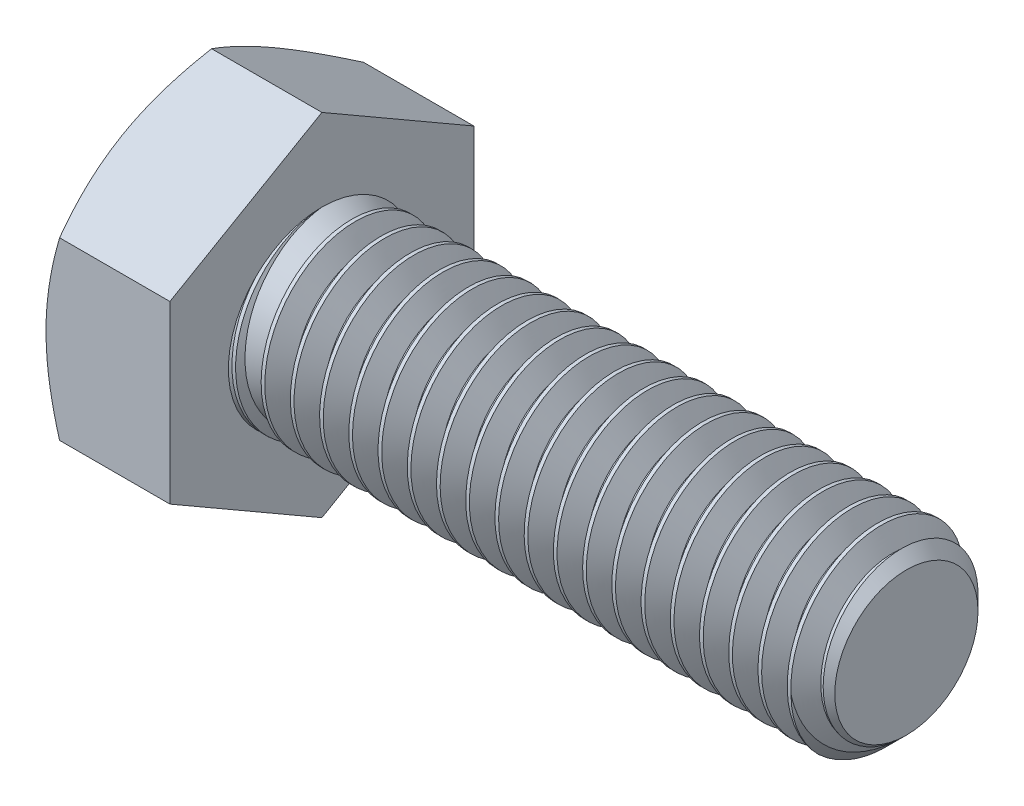
from build123d import *

# Parameters (mm, degrees)
SKETCH2_R           = 4
BOSS_EXTRUDE1_DEPTH = 25
CHAMFER1_SIZE       = 0.9375
BOSS_EXTRUDE2_DEPTH = 5.3
SKETCH6_OUTSIDE_W   = 136.164
SKETCH6_OUTSIDE_H   = 138.176
SKETCH6_OUTSIDE_R   = 6.5
CUT_EXTRUDE1_DEPTH  = 32.885315324
CUT_EXTRUDE1_DRAFT  = -60
SKETCH7_W           = 0.346153846
SKETCH7_H           = 0.346153846
CUT_EXTRUDE2_DEPTH  = 0.5
CUT_SWEEP1_PITCH    = 1.25
CUT_SWEEP1_TO       = 25


with BuildPart() as part:
    # Sketch2 → Boss-Extrude1 (new body)
    with BuildSketch(Plane(origin=(15.15, 0, 0), x_dir=(0, 0, -1), z_dir=(1, 0, 0))):
        Circle(SKETCH2_R)
    extrude(amount=-BOSS_EXTRUDE1_DEPTH)

    # Chamfer1
    chamfer1_edges = [part.edges().sort_by_distance(p)[0] for p in [
        (15.15, 0, 4),
    ]]
    chamfer(chamfer1_edges, length=CHAMFER1_SIZE)

    # Cut-Sweep1: arcs per turn and ends read off the stored shape
    # Cut-Sweep1: the profile of Sketch5 profile screwed along a right-hand helix through 21 turns, 8 arcs to a turn; built about Z, then put on its axis
    cut_sweep1_z = Axis((0, 0, 0), (0, 0, 1))
    cut_sweep1_corners = [(4.0003, 0, 0.000173205), (3.188101184, 0, -0.46875), (3.188101184, 0, -0.625), (4.0003, 0, -1.093923205)]
    with BuildLine(mode=Mode.PRIVATE) as cut_sweep1_profile:
        Line(cut_sweep1_corners[0], cut_sweep1_corners[1])
        Line(cut_sweep1_corners[1], cut_sweep1_corners[2])
        Line(cut_sweep1_corners[2], cut_sweep1_corners[3])
        Line(cut_sweep1_corners[3], cut_sweep1_corners[0])
    cut_sweep1_cap = Face(cut_sweep1_profile.wire())
    cut_sweep1_turn_angles = [0, 22.5, 45, 67.5, 90, 112.5, 135, 157.5, 180, 202.5, 225, 247.5, 270, 292.5, 315, 337.5, 360]
    cut_sweep1_turn_weights = [1, 0.9238795325112867, 1, 0.9238795325112867, 1, 0.9238795325112867, 1, 0.9238795325112867, 1, 0.9238795325112867, 1, 0.9238795325112867, 1, 0.9238795325112867, 1, 0.9238795325112867, 1]
    cut_sweep1_turn_rails = [Edge.make_bspline([Vector(p[0], p[1], 0).rotate(cut_sweep1_z, cut_sweep1_turn_angles[k]) / cut_sweep1_turn_weights[k] + Vector(0, 0, p[2] + CUT_SWEEP1_PITCH * cut_sweep1_turn_angles[k] / 360) for k in range(17)], [0, 0, 0, 1, 1, 2, 2, 3, 3, 4, 4, 5, 5, 6, 6, 7, 7, 8, 8, 8], 2, cut_sweep1_turn_weights) for p in cut_sweep1_corners]
    cut_sweep1_turn_sides = [Face.make_surface_from_curves(cut_sweep1_turn_rails[p[0]], cut_sweep1_turn_rails[p[1]]) for p in [(0, 1), (1, 2), (2, 3), (3, 0)]]
    cut_sweep1 = Plane(origin=(15.15, 0, 0), x_dir=(0, 1, 0), z_dir=(-1, 0, 0)) * split(Solid(Shell([*[p.moved(Location((0, 0, CUT_SWEEP1_PITCH * i))) for i in range(21) for p in cut_sweep1_turn_sides], cut_sweep1_cap, cut_sweep1_cap.rotate(cut_sweep1_z, 7560).moved(Location((0, 0, CUT_SWEEP1_PITCH * 7560 / 360)))])), bisect_by=Plane.XY.offset(CUT_SWEEP1_TO), keep=Keep.BOTTOM, mode=Mode.PRIVATE)
    add(cut_sweep1, mode=Mode.SUBTRACT)

    # Sketch8 → Min Thread (revolve)
    with BuildSketch(Plane.XY, mode=Mode.PRIVATE) as min_thread_sk:
        Polygon((-9.86, 4), (-9.85, 4), (-2.92179677, 0), (-9.86, 0), align=None)
    revolve(min_thread_sk.sketch.rotate(Axis((-15.15, 0, 0), (1, 0, 0)), 90), axis=Axis((-15.15, 0, 0), (1, 0, 0)))


with BuildPart() as body_2:
    # Sketch3 → Boss-Extrude2 (new body)
    with BuildSketch(Plane.ZY.offset(9.85)):
        Polygon((-6.5, -3.75277675), (0, -7.505553499), (6.5, -3.75277675), (6.5, 3.75277675), (0, 7.505553499), (-6.5, 3.75277675), align=None)
    extrude(amount=BOSS_EXTRUDE2_DEPTH)


with BuildPart() as cut_extrude1_tool:
    # Sketch6 outside → Cut-Extrude1 (with draft: the straight prism first)
    with BuildSketch(Plane.ZY.offset(15.15)):
        Rectangle(SKETCH6_OUTSIDE_W, SKETCH6_OUTSIDE_H)
        Circle(SKETCH6_OUTSIDE_R, mode=Mode.SUBTRACT)
    extrude(amount=-CUT_EXTRUDE1_DEPTH)
    # Cut-Extrude1: the draft: its side faces are tilted about the plane it starts from
    cut_extrude1_sides = [cut_extrude1_tool.faces().sort_by_distance(p)[0] for p in [
        (1.292657662, -69.088, 0),
        (1.292657662, 0, 68.082),
        (1.292657662, 69.088, 0),
        (1.292657662, 0, -68.082),
        (1.292657662, 0, -6.5),
    ]]
    draft(cut_extrude1_sides, Plane.ZY.offset(15.15), CUT_EXTRUDE1_DRAFT)


with BuildPart() as body_2_1:
    add(body_2.part)

    # Cut-Extrude1: cut by cut_extrude1_tool
    add(cut_extrude1_tool.part, mode=Mode.SUBTRACT)

    # Sketch7 → Cut-Extrude2 (cut)
    # profile 1 of 3: a face of its own
    with BuildSketch(Plane.ZY.offset(15.15)):
        with BuildLine():
            add(Edge.make_bspline(
                [(-1.910336538, 3.64755609), (-1.943180426, 3.660404805), (-2.00615305, 3.685040052), (-2.091086884, 3.734342115), (-2.162969799, 3.791057647), (-2.220919166, 3.856554304), (-2.26508712, 3.929478092), (-2.296889792, 4.008899236), (-2.315517176, 4.095260198), (-2.317968755, 4.154976579), (-2.319230769, 4.185717147)],
                knots=[0, 0, 0, 0, 1.16287356, 2.229614231, 3.228817875, 4.173350329, 5.100165549, 6.029633206, 6.985702163, 8, 8, 8, 8], degree=3))
            add(Edge.make_bspline(
                [(-2.319230769, 4.185717147), (-2.318636798, 4.20937066), (-2.317470813, 4.255803243), (-2.307396443, 4.323935199), (-2.291260887, 4.389222658), (-2.268360758, 4.451481353), (-2.239670649, 4.51122373), (-2.20346857, 4.567355283), (-2.161856529, 4.621462402), (-2.11311, 4.671357913), (-2.059392168, 4.717057372), (-2.001207373, 4.757725402), (-1.938110384, 4.790981964), (-1.871153207, 4.818787252), (-1.800004772, 4.840555852), (-1.724414457, 4.855381482), (-1.644648734, 4.864811683), (-1.589991366, 4.866038709), (-1.562019231, 4.866666667)],
                knots=[0, 0, 0, 0, 0.994101948, 1.951453197, 2.889123786, 3.817215529, 4.736003873, 5.669743943, 6.620499649, 7.601567446, 8.596478358, 9.582687259, 10.579761808, 11.589151689, 12.62747492, 13.702346593, 14.8241243, 16, 16, 16, 16], degree=3))
            add(Edge.make_bspline(
                [(-1.562019231, 4.866666667), (-1.533868855, 4.866032333), (-1.479035099, 4.864796722), (-1.398845596, 4.855493227), (-1.322778257, 4.83989999), (-1.250877866, 4.817777112), (-1.183031069, 4.78949168), (-1.119683689, 4.754725171), (-1.060183601, 4.714050995), (-1.006051608, 4.6669841), (-0.956797946, 4.615884757), (-0.9141243, 4.561140064), (-0.877524473, 4.504027453), (-0.847280214, 4.444199951), (-0.824905397, 4.380976282), (-0.807850765, 4.31554761), (-0.797958287, 4.247136515), (-0.796762831, 4.200712466), (-0.796153846, 4.177063301)],
                knots=[0, 0, 0, 0, 1.171211919, 2.281388661, 3.353996503, 4.398126828, 5.406889753, 6.407389155, 7.400009931, 8.40008733, 9.387021643, 10.349004252, 11.283445052, 12.206096336, 13.131640667, 14.068727932, 15.016178647, 16, 16, 16, 16], degree=3))
            add(Edge.make_bspline(
                [(-0.796153846, 4.177063301), (-0.797143123, 4.147382227), (-0.799082909, 4.089183224), (-0.818850195, 4.005288878), (-0.849659202, 3.926969301), (-0.894187514, 3.855717128), (-0.950580964, 3.790796484), (-1.020560739, 3.734360256), (-1.103064068, 3.685135244), (-1.164446732, 3.66041967), (-1.196394231, 3.64755609)],
                knots=[0, 0, 0, 0, 0.998680737, 1.958225066, 2.887911823, 3.823713378, 4.77537694, 5.772726054, 6.840782926, 8, 8, 8, 8], degree=3))
            add(Edge.make_bspline(
                [(-1.196394231, 3.64755609), (-1.176237433, 3.640713812), (-1.136738854, 3.627305916), (-1.080899649, 3.601236835), (-1.028328715, 3.573128177), (-0.9787296, 3.542700537), (-0.933933129, 3.507691086), (-0.89244476, 3.470169786), (-0.854438929, 3.429607888), (-0.820434755, 3.38566041), (-0.790075954, 3.339249733), (-0.76408641, 3.290262707), (-0.74201399, 3.239396598), (-0.723150139, 3.18641553), (-0.709371588, 3.13094631), (-0.699730919, 3.073243849), (-0.693614187, 3.013612259), (-0.692747719, 2.973111786), (-0.692307692, 2.952544071)],
                knots=[0, 0, 0, 0, 1.104208047, 2.163768705, 3.193778962, 4.198696312, 5.179575955, 6.14024585, 7.100368562, 8.060719304, 9.021161243, 9.975749006, 10.935506756, 11.897452199, 12.89163552, 13.897859372, 14.932451246, 16, 16, 16, 16], degree=3))
            add(Edge.make_bspline(
                [(-0.692307692, 2.952544071), (-0.692995599, 2.924196188), (-0.694350828, 2.868348698), (-0.706258296, 2.786371137), (-0.724274822, 2.707620503), (-0.750544997, 2.632429469), (-0.784098538, 2.560744881), (-0.825604673, 2.492670833), (-0.874655591, 2.428277351), (-0.929804375, 2.367364281), (-0.991460683, 2.312301503), (-1.058161387, 2.263779047), (-1.130156757, 2.223135303), (-1.206573243, 2.189482429), (-1.287776753, 2.163401577), (-1.373662906, 2.14513945), (-1.464203122, 2.134265157), (-1.526111717, 2.132799128), (-1.557692308, 2.132051282)],
                knots=[0, 0, 0, 0, 1.017598406, 2.004746413, 2.969099523, 3.915171376, 4.859468899, 5.806714415, 6.772805022, 7.762836953, 8.753334612, 9.736396794, 10.719437652, 11.716790048, 12.730404696, 13.776887535, 14.865953843, 16, 16, 16, 16], degree=3))
            add(Edge.make_bspline(
                [(-1.557692308, 2.132051282), (-1.589269739, 2.132815245), (-1.651172142, 2.134312869), (-1.74179508, 2.144964853), (-1.827558352, 2.164054851), (-1.908656278, 2.190162214), (-1.985528787, 2.222903933), (-2.05704064, 2.264463483), (-2.124177032, 2.312924465), (-2.185876211, 2.368327822), (-2.241483088, 2.429234395), (-2.289887407, 2.494578868), (-2.331147142, 2.563355612), (-2.365103008, 2.635952336), (-2.390985122, 2.712369703), (-2.409149496, 2.792320814), (-2.421078516, 2.875744574), (-2.422401401, 2.932670136), (-2.423076923, 2.961738782)],
                knots=[0, 0, 0, 0, 1.127066097, 2.209429196, 3.250843736, 4.258219581, 5.246860502, 6.227045772, 7.204057202, 8.19754525, 9.181483529, 10.142920909, 11.095356922, 12.039670968, 12.998174893, 13.969127444, 14.962948905, 16, 16, 16, 16], degree=3))
            add(Edge.make_bspline(
                [(-2.423076923, 2.961738782), (-2.422607384, 2.983382552), (-2.421686068, 3.025851375), (-2.41605806, 3.08814158), (-2.404841548, 3.147510694), (-2.390393966, 3.204308577), (-2.372050057, 3.258677322), (-2.349419354, 3.310189972), (-2.321962481, 3.358722026), (-2.290769673, 3.404589279), (-2.255447312, 3.447469728), (-2.216567893, 3.486987858), (-2.173990186, 3.522694177), (-2.12867099, 3.555631559), (-2.078710685, 3.58347011), (-2.02596728, 3.609017167), (-1.969533975, 3.63080407), (-1.930266639, 3.641916159), (-1.910336538, 3.64755609)],
                knots=[0, 0, 0, 0, 1.117345089, 2.192424383, 3.22371675, 4.232639188, 5.215561493, 6.182180952, 7.132172269, 8.089790513, 9.041830748, 9.996006267, 10.94686322, 11.907506267, 12.882866327, 13.894317773, 14.931262935, 16, 16, 16, 16], degree=3))
        make_face()
        with BuildLine():
            add(Edge.make_bspline(
                [(-1.973076923, 4.184094551), (-1.972049542, 4.156538278), (-1.970064187, 4.103287334), (-1.948473236, 4.027648269), (-1.914711255, 3.959703177), (-1.875131256, 3.910430969), (-1.837183978, 3.876859266), (-1.805511748, 3.854444632), (-1.770900126, 3.835415061), (-1.733098366, 3.820624078), (-1.693022029, 3.807520188), (-1.649288938, 3.800196066), (-1.602927014, 3.79424199), (-1.570875935, 3.793810776), (-1.554447115, 3.793589744)],
                knots=[0, 0, 0, 0, 1.528727296, 2.954179336, 4.335216052, 5.725683216, 6.435919001, 7.148062981, 7.879427438, 8.626027458, 9.402978632, 10.2190538, 11.08711833, 12, 12, 12, 12], degree=3))
            add(Edge.make_bspline(
                [(-1.554447115, 3.793589744), (-1.538380947, 3.793818944), (-1.507052798, 3.794265872), (-1.461735055, 3.800098562), (-1.418909946, 3.807888668), (-1.3792103, 3.819693376), (-1.342177786, 3.83504294), (-1.308414724, 3.853965163), (-1.276910759, 3.875712227), (-1.240078231, 3.909540416), (-1.200552852, 3.957086917), (-1.166677726, 4.021996805), (-1.145568189, 4.093012076), (-1.143413605, 4.142478353), (-1.142307692, 4.16786859)],
                knots=[0, 0, 0, 0, 0.922112375, 1.798068639, 2.620552757, 3.419964248, 4.17189205, 4.918165909, 5.639229138, 6.36503528, 7.785020832, 9.165298717, 10.544993853, 12, 12, 12, 12], degree=3))
            add(Edge.make_bspline(
                [(-1.142307692, 4.16786859), (-1.143640162, 4.194146397), (-1.14624746, 4.245565262), (-1.167305433, 4.31937936), (-1.202758374, 4.386232888), (-1.243258445, 4.435055073), (-1.280742538, 4.470423871), (-1.312812092, 4.49293848), (-1.347286981, 4.512100404), (-1.384298418, 4.527748695), (-1.423899923, 4.540369204), (-1.466198772, 4.548648866), (-1.511017225, 4.554455684), (-1.541806577, 4.554899314), (-1.557692308, 4.555128205)],
                knots=[0, 0, 0, 0, 1.480633456, 2.897216237, 4.289382554, 5.720567045, 6.454675042, 7.191244726, 7.924224627, 8.676083236, 9.454506446, 10.26432127, 11.104478565, 12, 12, 12, 12], degree=3))
            add(Edge.make_bspline(
                [(-1.557692308, 4.555128205), (-1.573579806, 4.554906717), (-1.604551709, 4.554474937), (-1.64966241, 4.548493868), (-1.692362125, 4.540981766), (-1.732256921, 4.528926234), (-1.769180969, 4.513172455), (-1.803519942, 4.493999768), (-1.835528731, 4.472060259), (-1.873276176, 4.438268612), (-1.912810406, 4.390721035), (-1.947638951, 4.326847835), (-1.969164119, 4.25720449), (-1.9717565, 4.208766379), (-1.973076923, 4.184094551)],
                knots=[0, 0, 0, 0, 0.914830409, 1.783417199, 2.618873138, 3.411020283, 4.179090249, 4.927874451, 5.674348476, 6.410336976, 7.841713217, 9.213201474, 10.580551314, 12, 12, 12, 12], degree=3))
        make_face(mode=Mode.SUBTRACT)
        with BuildLine():
            add(Edge.make_bspline(
                [(-2.076923077, 2.968229167), (-2.076324499, 2.94601804), (-2.075125766, 2.901537279), (-2.064610298, 2.835473923), (-2.046767727, 2.770640787), (-2.023899366, 2.706976633), (-1.99164212, 2.647051056), (-1.948865385, 2.593563069), (-1.895188595, 2.548593595), (-1.833886765, 2.510601677), (-1.766990707, 2.48069877), (-1.697283059, 2.459825525), (-1.626562939, 2.446033526), (-1.578849029, 2.444404431), (-1.554987981, 2.443589744)],
                knots=[0, 0, 0, 0, 0.957879255, 1.91828174, 2.876792425, 3.856375228, 4.831004356, 5.799187063, 6.79220414, 7.836856316, 8.902268238, 9.943090861, 10.971368942, 12, 12, 12, 12], degree=3))
            add(Edge.make_bspline(
                [(-1.554987981, 2.443589744), (-1.535311973, 2.443923041), (-1.497087099, 2.444570542), (-1.441367202, 2.451969635), (-1.388866461, 2.463196478), (-1.339344347, 2.478590321), (-1.29352977, 2.499650117), (-1.250676659, 2.524264444), (-1.211223346, 2.554012742), (-1.175181001, 2.58796306), (-1.142916712, 2.625518474), (-1.115278268, 2.666032559), (-1.091168927, 2.708365957), (-1.071484753, 2.753432288), (-1.057249922, 2.801324481), (-1.04626574, 2.851178458), (-1.039639307, 2.903508437), (-1.038859818, 2.939183641), (-1.038461538, 2.957411859)],
                knots=[0, 0, 0, 0, 1.149387474, 2.232932207, 3.278773642, 4.285224938, 5.256757121, 6.220082341, 7.168479488, 8.137608443, 9.109140627, 10.056190326, 10.999892409, 11.953252726, 12.923240661, 13.915357002, 14.934853301, 16, 16, 16, 16], degree=3))
            add(Edge.make_bspline(
                [(-1.038461538, 2.957411859), (-1.038872502, 2.975997875), (-1.039677104, 3.012386334), (-1.046135137, 3.065864847), (-1.057735242, 3.116595931), (-1.072653025, 3.165345986), (-1.092870887, 3.211266899), (-1.117139599, 3.255017122), (-1.146858912, 3.295443496), (-1.17944851, 3.333918503), (-1.216329021, 3.368747278), (-1.257056648, 3.398781447), (-1.300340642, 3.425306704), (-1.347490381, 3.445653816), (-1.397467093, 3.461952316), (-1.45050821, 3.473795055), (-1.506829994, 3.481034206), (-1.545410167, 3.48170571), (-1.565264423, 3.482051282)],
                knots=[0, 0, 0, 0, 1.065858887, 2.086781919, 3.082735321, 4.047496077, 5.006086125, 5.955204095, 6.910833714, 7.878747924, 8.844339535, 9.812198509, 10.776903849, 11.749116737, 12.749729282, 13.788304076, 14.861809717, 16, 16, 16, 16], degree=3))
            add(Edge.make_bspline(
                [(-1.565264423, 3.482051282), (-1.584579524, 3.481702271), (-1.622443135, 3.481018101), (-1.677448497, 3.473737944), (-1.729521675, 3.462558037), (-1.778204528, 3.446194755), (-1.824105741, 3.425747171), (-1.866385797, 3.400035797), (-1.90579897, 3.370192229), (-1.941141327, 3.335504758), (-1.973029292, 3.297824733), (-2.000599852, 3.257431862), (-2.024955649, 3.215263139), (-2.043438748, 3.169934854), (-2.059083037, 3.122912387), (-2.068863192, 3.073283084), (-2.07581566, 3.02161082), (-2.076548543, 2.986283126), (-2.076923077, 2.968229167)],
                knots=[0, 0, 0, 0, 1.135239447, 2.225422834, 3.256957183, 4.262780498, 5.240265059, 6.205773948, 7.16638056, 8.141101257, 9.111719309, 10.064571387, 11.014055337, 11.969087385, 12.938082716, 13.92369833, 14.938921288, 16, 16, 16, 16], degree=3))
        make_face(mode=Mode.SUBTRACT)
    # profile 2 of 3: a face of its own
    with BuildSketch(Plane.ZY.offset(15.15)):
        with Locations((0, 2.33974359)):
            Rectangle(SKETCH7_W, SKETCH7_H)
    # profile 3 of 3: a face of its own
    with BuildSketch(Plane.ZY.offset(15.15)):
        with BuildLine():
            add(Edge.make_bspline(
                [(1.205048077, 3.64755609), (1.172204189, 3.660404805), (1.109231566, 3.685040052), (1.024297731, 3.734342115), (0.952414817, 3.791057647), (0.894465449, 3.856554304), (0.850297496, 3.929478092), (0.818494823, 4.008899236), (0.79986744, 4.095260198), (0.797415861, 4.154976579), (0.796153846, 4.185717147)],
                knots=[0, 0, 0, 0, 1.16287356, 2.229614231, 3.228817875, 4.173350329, 5.100165549, 6.029633206, 6.985702163, 8, 8, 8, 8], degree=3))
            add(Edge.make_bspline(
                [(0.796153846, 4.185717147), (0.796747818, 4.20937066), (0.797913802, 4.255803243), (0.807988173, 4.323935199), (0.824123729, 4.389222658), (0.847023858, 4.451481353), (0.875713967, 4.51122373), (0.911916045, 4.567355283), (0.953528087, 4.621462402), (1.002274615, 4.671357913), (1.055992447, 4.717057372), (1.114177243, 4.757725402), (1.177274232, 4.790981964), (1.244231409, 4.818787252), (1.315379843, 4.840555852), (1.390970158, 4.855381482), (1.470735882, 4.864811683), (1.52539325, 4.866038709), (1.553365385, 4.866666667)],
                knots=[0, 0, 0, 0, 0.994101948, 1.951453197, 2.889123786, 3.817215529, 4.736003873, 5.669743943, 6.620499649, 7.601567446, 8.596478358, 9.582687259, 10.579761808, 11.589151689, 12.62747492, 13.702346593, 14.8241243, 16, 16, 16, 16], degree=3))
            add(Edge.make_bspline(
                [(1.553365385, 4.866666667), (1.581515761, 4.866032333), (1.636349517, 4.864796722), (1.71653902, 4.855493227), (1.792606359, 4.83989999), (1.86450675, 4.817777112), (1.932353546, 4.78949168), (1.995700927, 4.754725171), (2.055201014, 4.714050995), (2.109333008, 4.6669841), (2.15858667, 4.615884757), (2.201260315, 4.561140064), (2.237860143, 4.504027453), (2.268104401, 4.444199951), (2.290479218, 4.380976282), (2.307533851, 4.31554761), (2.317426328, 4.247136515), (2.318621785, 4.200712466), (2.319230769, 4.177063301)],
                knots=[0, 0, 0, 0, 1.171211919, 2.281388661, 3.353996503, 4.398126828, 5.406889753, 6.407389155, 7.400009931, 8.40008733, 9.387021643, 10.349004252, 11.283445052, 12.206096336, 13.131640667, 14.068727932, 15.016178647, 16, 16, 16, 16], degree=3))
            add(Edge.make_bspline(
                [(2.319230769, 4.177063301), (2.318241492, 4.147382227), (2.316301706, 4.089183224), (2.29653442, 4.005288878), (2.265725413, 3.926969301), (2.221197102, 3.855717128), (2.164803651, 3.790796484), (2.094823877, 3.734360256), (2.012320548, 3.685135244), (1.950937884, 3.66041967), (1.918990385, 3.64755609)],
                knots=[0, 0, 0, 0, 0.998680737, 1.958225066, 2.887911823, 3.823713378, 4.77537694, 5.772726054, 6.840782926, 8, 8, 8, 8], degree=3))
            add(Edge.make_bspline(
                [(1.918990385, 3.64755609), (1.939147182, 3.640713812), (1.978645761, 3.627305916), (2.034484967, 3.601236835), (2.0870559, 3.573128177), (2.136655016, 3.542700537), (2.181451487, 3.507691086), (2.222939855, 3.470169786), (2.260945686, 3.429607888), (2.29494986, 3.38566041), (2.325308662, 3.339249733), (2.351298205, 3.290262707), (2.373370626, 3.239396598), (2.392234476, 3.18641553), (2.406013028, 3.13094631), (2.415653696, 3.073243849), (2.421770428, 3.013612259), (2.422636897, 2.973111786), (2.423076923, 2.952544071)],
                knots=[0, 0, 0, 0, 1.104208047, 2.163768705, 3.193778962, 4.198696312, 5.179575955, 6.14024585, 7.100368562, 8.060719304, 9.021161243, 9.975749006, 10.935506756, 11.897452199, 12.89163552, 13.897859372, 14.932451246, 16, 16, 16, 16], degree=3))
            add(Edge.make_bspline(
                [(2.423076923, 2.952544071), (2.422389016, 2.924196188), (2.421033787, 2.868348698), (2.409126319, 2.786371137), (2.391109793, 2.707620503), (2.364839618, 2.632429469), (2.331286078, 2.560744881), (2.289779943, 2.492670833), (2.240729025, 2.428277351), (2.18558024, 2.367364281), (2.123923933, 2.312301503), (2.057223228, 2.263779047), (1.985227858, 2.223135303), (1.908811373, 2.189482429), (1.827607862, 2.163401577), (1.741721709, 2.14513945), (1.651181493, 2.134265157), (1.589272898, 2.132799128), (1.557692308, 2.132051282)],
                knots=[0, 0, 0, 0, 1.017598406, 2.004746413, 2.969099523, 3.915171376, 4.859468899, 5.806714415, 6.772805022, 7.762836953, 8.753334612, 9.736396794, 10.719437652, 11.716790048, 12.730404696, 13.776887535, 14.865953843, 16, 16, 16, 16], degree=3))
            add(Edge.make_bspline(
                [(1.557692308, 2.132051282), (1.526114876, 2.132815245), (1.464212473, 2.134312869), (1.373589535, 2.144964853), (1.287826264, 2.164054851), (1.206728338, 2.190162214), (1.129855828, 2.222903933), (1.058343976, 2.264463483), (0.991207584, 2.312924465), (0.929508405, 2.368327822), (0.873901528, 2.429234395), (0.825497209, 2.494578868), (0.784237474, 2.563355612), (0.750281607, 2.635952336), (0.724399494, 2.712369703), (0.70623512, 2.792320814), (0.694306099, 2.875744574), (0.692983214, 2.932670136), (0.692307692, 2.961738782)],
                knots=[0, 0, 0, 0, 1.127066097, 2.209429196, 3.250843736, 4.258219581, 5.246860502, 6.227045772, 7.204057202, 8.19754525, 9.181483529, 10.142920909, 11.095356922, 12.039670968, 12.998174893, 13.969127444, 14.962948905, 16, 16, 16, 16], degree=3))
            add(Edge.make_bspline(
                [(0.692307692, 2.961738782), (0.692777231, 2.983382552), (0.693698547, 3.025851375), (0.699326555, 3.08814158), (0.710543067, 3.147510694), (0.724990649, 3.204308577), (0.743334558, 3.258677322), (0.765965261, 3.310189972), (0.793422134, 3.358722026), (0.824614942, 3.404589279), (0.859937303, 3.447469728), (0.898816723, 3.486987858), (0.941394429, 3.522694177), (0.986713626, 3.555631559), (1.03667393, 3.58347011), (1.089417335, 3.609017167), (1.14585064, 3.63080407), (1.185117977, 3.641916159), (1.205048077, 3.64755609)],
                knots=[0, 0, 0, 0, 1.117345089, 2.192424383, 3.22371675, 4.232639188, 5.215561493, 6.182180952, 7.132172269, 8.089790513, 9.041830748, 9.996006267, 10.94686322, 11.907506267, 12.882866327, 13.894317773, 14.931262935, 16, 16, 16, 16], degree=3))
        make_face()
        with BuildLine():
            add(Edge.make_bspline(
                [(1.142307692, 4.184094551), (1.143335073, 4.156538278), (1.145320428, 4.103287334), (1.166911379, 4.027648269), (1.200673361, 3.959703177), (1.240253359, 3.910430969), (1.278200638, 3.876859266), (1.309872867, 3.854444632), (1.344484489, 3.835415061), (1.382286249, 3.820624078), (1.422362587, 3.807520188), (1.466095677, 3.800196066), (1.512457601, 3.79424199), (1.544508681, 3.793810776), (1.5609375, 3.793589744)],
                knots=[0, 0, 0, 0, 1.528727296, 2.954179336, 4.335216052, 5.725683216, 6.435919001, 7.148062981, 7.879427438, 8.626027458, 9.402978632, 10.2190538, 11.08711833, 12, 12, 12, 12], degree=3))
            add(Edge.make_bspline(
                [(1.5609375, 3.793589744), (1.577003668, 3.793818944), (1.608331817, 3.794265872), (1.65364956, 3.800098562), (1.69647467, 3.807888668), (1.736174316, 3.819693376), (1.773206829, 3.83504294), (1.806969892, 3.853965163), (1.838473857, 3.875712227), (1.875306385, 3.909540416), (1.914831763, 3.957086917), (1.94870689, 4.021996805), (1.969816426, 4.093012076), (1.97197101, 4.142478353), (1.973076923, 4.16786859)],
                knots=[0, 0, 0, 0, 0.922112375, 1.798068639, 2.620552757, 3.419964248, 4.17189205, 4.918165909, 5.639229138, 6.36503528, 7.785020832, 9.165298717, 10.544993853, 12, 12, 12, 12], degree=3))
            add(Edge.make_bspline(
                [(1.973076923, 4.16786859), (1.971744453, 4.194146397), (1.969137155, 4.245565262), (1.948079182, 4.31937936), (1.912626241, 4.386232888), (1.872126171, 4.435055073), (1.834642077, 4.470423871), (1.802572524, 4.49293848), (1.768097634, 4.512100404), (1.731086197, 4.527748695), (1.691484692, 4.540369204), (1.649185843, 4.548648866), (1.604367391, 4.554455684), (1.573578038, 4.554899314), (1.557692308, 4.555128205)],
                knots=[0, 0, 0, 0, 1.480633456, 2.897216237, 4.289382554, 5.720567045, 6.454675042, 7.191244726, 7.924224627, 8.676083236, 9.454506446, 10.26432127, 11.104478565, 12, 12, 12, 12], degree=3))
            add(Edge.make_bspline(
                [(1.557692308, 4.555128205), (1.541804809, 4.554906717), (1.510832906, 4.554474937), (1.465722205, 4.548493868), (1.42302249, 4.540981766), (1.383127694, 4.528926234), (1.346203646, 4.513172455), (1.311864674, 4.493999768), (1.279855884, 4.472060259), (1.242108439, 4.438268612), (1.202574209, 4.390721035), (1.167745664, 4.326847835), (1.146220497, 4.25720449), (1.143628115, 4.208766379), (1.142307692, 4.184094551)],
                knots=[0, 0, 0, 0, 0.914830409, 1.783417199, 2.618873138, 3.411020283, 4.179090249, 4.927874451, 5.674348476, 6.410336976, 7.841713217, 9.213201474, 10.580551314, 12, 12, 12, 12], degree=3))
        make_face(mode=Mode.SUBTRACT)
        with BuildLine():
            add(Edge.make_bspline(
                [(1.038461538, 2.968229167), (1.039060117, 2.94601804), (1.04025885, 2.901537279), (1.050774318, 2.835473923), (1.068616889, 2.770640787), (1.09148525, 2.706976633), (1.123742495, 2.647051056), (1.16651923, 2.593563069), (1.220196021, 2.548593595), (1.281497851, 2.510601677), (1.348393908, 2.48069877), (1.418101556, 2.459825525), (1.488821677, 2.446033526), (1.536535586, 2.444404431), (1.560396635, 2.443589744)],
                knots=[0, 0, 0, 0, 0.957879255, 1.91828174, 2.876792425, 3.856375228, 4.831004356, 5.799187063, 6.79220414, 7.836856316, 8.902268238, 9.943090861, 10.971368942, 12, 12, 12, 12], degree=3))
            add(Edge.make_bspline(
                [(1.560396635, 2.443589744), (1.580072642, 2.443923041), (1.618297516, 2.444570542), (1.674017414, 2.451969635), (1.726518155, 2.463196478), (1.776040269, 2.478590321), (1.821854845, 2.499650117), (1.864707956, 2.524264444), (1.904161269, 2.554012742), (1.940203615, 2.58796306), (1.972467904, 2.625518474), (2.000106347, 2.666032559), (2.024215688, 2.708365957), (2.043899862, 2.753432288), (2.058134693, 2.801324481), (2.069118876, 2.851178458), (2.075745308, 2.903508437), (2.076524797, 2.939183641), (2.076923077, 2.957411859)],
                knots=[0, 0, 0, 0, 1.149387474, 2.232932207, 3.278773642, 4.285224938, 5.256757121, 6.220082341, 7.168479488, 8.137608443, 9.109140627, 10.056190326, 10.999892409, 11.953252726, 12.923240661, 13.915357002, 14.934853301, 16, 16, 16, 16], degree=3))
            add(Edge.make_bspline(
                [(2.076923077, 2.957411859), (2.076512113, 2.975997875), (2.075707511, 3.012386334), (2.069249478, 3.065864847), (2.057649373, 3.116595931), (2.04273159, 3.165345986), (2.022513728, 3.211266899), (1.998245016, 3.255017122), (1.968525703, 3.295443496), (1.935936106, 3.333918503), (1.899055595, 3.368747278), (1.858327967, 3.398781447), (1.815043974, 3.425306704), (1.767894234, 3.445653816), (1.717917522, 3.461952316), (1.664876406, 3.473795055), (1.608554621, 3.481034206), (1.569974448, 3.48170571), (1.550120192, 3.482051282)],
                knots=[0, 0, 0, 0, 1.065858887, 2.086781919, 3.082735321, 4.047496077, 5.006086125, 5.955204095, 6.910833714, 7.878747924, 8.844339535, 9.812198509, 10.776903849, 11.749116737, 12.749729282, 13.788304076, 14.861809717, 16, 16, 16, 16], degree=3))
            add(Edge.make_bspline(
                [(1.550120192, 3.482051282), (1.530805092, 3.481702271), (1.49294148, 3.481018101), (1.437936118, 3.473737944), (1.38586294, 3.462558037), (1.337180087, 3.446194755), (1.291278874, 3.425747171), (1.248998818, 3.400035797), (1.209585646, 3.370192229), (1.174243289, 3.335504758), (1.142355324, 3.297824733), (1.114784763, 3.257431862), (1.090428967, 3.215263139), (1.071945868, 3.169934854), (1.056301579, 3.122912387), (1.046521424, 3.073283084), (1.039568956, 3.02161082), (1.038836073, 2.986283126), (1.038461538, 2.968229167)],
                knots=[0, 0, 0, 0, 1.135239447, 2.225422834, 3.256957183, 4.262780498, 5.240265059, 6.205773948, 7.16638056, 8.141101257, 9.111719309, 10.064571387, 11.014055337, 11.969087385, 12.938082716, 13.92369833, 14.938921288, 16, 16, 16, 16], degree=3))
        make_face(mode=Mode.SUBTRACT)
    extrude(amount=-CUT_EXTRUDE2_DEPTH, mode=Mode.SUBTRACT)


with BuildPart() as part_1:
    add(part.part)

    # Combine1: union body 2
    add(body_2_1.part)


solid = part_1.part
